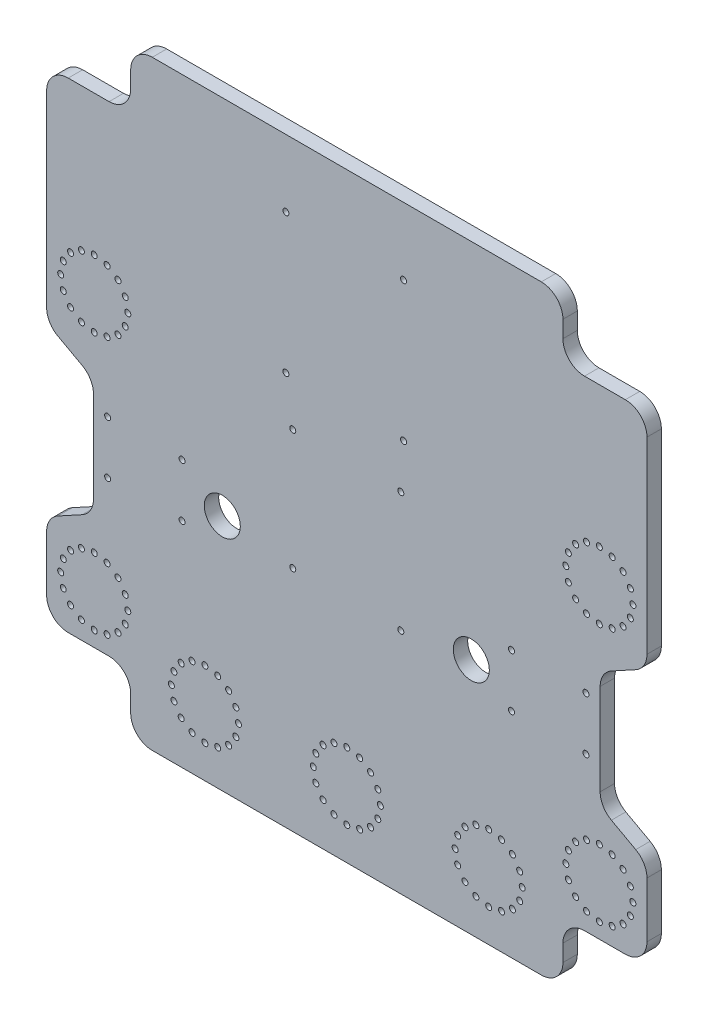
from build123d import *

# Parameters (mm, degrees)
SKETCH1_W               = 300
SKETCH1_H               = 250
BOSS_EXTRUDE1_DEPTH     = 6
CUT_EXTRUDE1_DEPTH      = 391.558574352
CUT_EXTRUDE1_DEPTH_BACK = 391.558574352
SKETCH3_R               = 7.5
SKETCH8_R               = 1.25
CUT_EXTRUDE4_DEPTH      = 382.041008292
SKETCH6_W               = 12.5
SKETCH6_H               = 92.656290199
SKETCH6_W_2             = 35
SKETCH6_H_2             = 25
CUT_EXTRUDE3_DEPTH      = 382.041008292
SKETCH5_R               = 1.25
CUT_EXTRUDE2_DEPTH      = 372.700147969
FILLET1_R               = 9


with BuildPart() as part:
    # Sketch1 → Boss-Extrude1 (new body)
    with BuildSketch(Plane.XY):
        with Locations((150, 125)):
            Rectangle(SKETCH1_W, SKETCH1_H)
    extrude(amount=-BOSS_EXTRUDE1_DEPTH)

    # Sketch3 → Cut-Extrude1 (cut, two sides: drawn at the far end of the back side and taken through both)
    with BuildSketch(Plane.XY.offset(-CUT_EXTRUDE1_DEPTH_BACK)):
        Polygon((0, 0), (25, 0), (25, 62.343709801), (44.5, 73.000027506), (44.5, 121.687392097), (25, 132.343709801), (12.5, 132.343709801), (12.5, 225), (25, 225), (25, 250), (0, 250), align=None)
        Polygon((275, 0), (300, 0), (300, 250), (275, 250), (275, 225), (287.5, 225), (287.5, 132.343709801), (275, 132.343709801), (255.5, 121.687392097), (255.5, 73.000027506), (275, 62.343709801), align=None)
        with Locations((201.85, 99.125843129)):
            Circle(SKETCH3_R)
        with Locations((98.15, 99.125843129)):
            Circle(SKETCH3_R)
    extrude(amount=CUT_EXTRUDE1_DEPTH + CUT_EXTRUDE1_DEPTH_BACK, mode=Mode.SUBTRACT)

    # Sketch8 → Cut-Extrude4 (cut, through all)
    with BuildSketch(Plane.XY):
        with Locations((209.09, 41.63)):
            Circle(SKETCH8_R)
        with Locations((209.09, 13.69)):
            Circle(SKETCH8_R)
        with Locations((214.43608755, 40.566597069)):
            Circle(SKETCH8_R)
        with Locations((203.74391245, 14.753402931)):
            Circle(SKETCH8_R)
        with Locations((218.968281733, 37.538281733)):
            Circle(SKETCH8_R)
        with Locations((199.211718267, 17.781718267)):
            Circle(SKETCH8_R)
        with Locations((221.996597069, 33.00608755)):
            Circle(SKETCH8_R)
        with Locations((196.183402931, 22.31391245)):
            Circle(SKETCH8_R)
        with Locations((223.06, 27.66)):
            Circle(SKETCH8_R)
        with Locations((195.12, 27.66)):
            Circle(SKETCH8_R)
        with Locations((221.996597069, 22.31391245)):
            Circle(SKETCH8_R)
        with Locations((196.183402931, 33.00608755)):
            Circle(SKETCH8_R)
        with Locations((218.968281733, 17.781718267)):
            Circle(SKETCH8_R)
        with Locations((199.211718267, 37.538281733)):
            Circle(SKETCH8_R)
        with Locations((214.43608755, 14.753402931)):
            Circle(SKETCH8_R)
        with Locations((203.74391245, 40.566597069)):
            Circle(SKETCH8_R)
        with Locations((76.94, 27.66)):
            Circle(SKETCH8_R)
        with Locations((104.88, 27.66)):
            Circle(SKETCH8_R)
        with Locations((255.16893536, 59.271223716)):
            Circle(SKETCH8_R)
        with Locations((103.816597069, 22.31391245)):
            Circle(SKETCH8_R)
        with Locations((78.003402931, 33.00608755)):
            Circle(SKETCH8_R)
        with Locations((100.788281733, 17.781718267)):
            Circle(SKETCH8_R)
        with Locations((81.031718267, 37.538281733)):
            Circle(SKETCH8_R)
        with Locations((96.25608755, 14.753402931)):
            Circle(SKETCH8_R)
        with Locations((85.56391245, 40.566597069)):
            Circle(SKETCH8_R)
        with Locations((90.91, 13.69)):
            Circle(SKETCH8_R)
        with Locations((90.91, 41.63)):
            Circle(SKETCH8_R)
        with Locations((85.56391245, 14.753402931)):
            Circle(SKETCH8_R)
        with Locations((96.25608755, 40.566597069)):
            Circle(SKETCH8_R)
        with Locations((81.031718267, 17.781718267)):
            Circle(SKETCH8_R)
        with Locations((100.788281733, 37.538281733)):
            Circle(SKETCH8_R)
        with Locations((78.003402931, 22.31391245)):
            Circle(SKETCH8_R)
        with Locations((103.816597069, 33.00608755)):
            Circle(SKETCH8_R)
        with Locations((255.16893536, 31.331223716)):
            Circle(SKETCH8_R)
        with Locations((260.51502291, 58.207820785)):
            Circle(SKETCH8_R)
        with Locations((249.82284781, 32.394626647)):
            Circle(SKETCH8_R)
        with Locations((265.047217093, 55.179505449)):
            Circle(SKETCH8_R)
        with Locations((245.290653627, 35.422941983)):
            Circle(SKETCH8_R)
        with Locations((268.075532429, 50.647311266)):
            Circle(SKETCH8_R)
        with Locations((242.262338291, 39.955136166)):
            Circle(SKETCH8_R)
        with Locations((269.13893536, 45.301223716)):
            Circle(SKETCH8_R)
        with Locations((241.19893536, 45.301223716)):
            Circle(SKETCH8_R)
        with Locations((268.075532429, 39.955136166)):
            Circle(SKETCH8_R)
        with Locations((242.262338291, 50.647311266)):
            Circle(SKETCH8_R)
        with Locations((265.047217093, 35.422941983)):
            Circle(SKETCH8_R)
        with Locations((245.290653627, 55.179505449)):
            Circle(SKETCH8_R)
        with Locations((260.51502291, 32.394626647)):
            Circle(SKETCH8_R)
        with Locations((249.82284781, 58.207820785)):
            Circle(SKETCH8_R)
        with Locations((44.83106464, 59.271223716)):
            Circle(SKETCH8_R)
        with Locations((44.83106464, 31.331223716)):
            Circle(SKETCH8_R)
        with Locations((50.17715219, 58.207820785)):
            Circle(SKETCH8_R)
        with Locations((39.48497709, 32.394626647)):
            Circle(SKETCH8_R)
        with Locations((54.709346373, 55.179505449)):
            Circle(SKETCH8_R)
        with Locations((34.952782907, 35.422941983)):
            Circle(SKETCH8_R)
        with Locations((57.737661709, 50.647311266)):
            Circle(SKETCH8_R)
        with Locations((31.924467571, 39.955136166)):
            Circle(SKETCH8_R)
        with Locations((58.80106464, 45.301223716)):
            Circle(SKETCH8_R)
        with Locations((30.86106464, 45.301223716)):
            Circle(SKETCH8_R)
        with Locations((57.737661709, 39.955136166)):
            Circle(SKETCH8_R)
        with Locations((31.924467571, 50.647311266)):
            Circle(SKETCH8_R)
        with Locations((54.709346373, 35.422941983)):
            Circle(SKETCH8_R)
        with Locations((34.952782907, 55.179505449)):
            Circle(SKETCH8_R)
        with Locations((50.17715219, 32.394626647)):
            Circle(SKETCH8_R)
        with Locations((39.48497709, 58.207820785)):
            Circle(SKETCH8_R)
        with Locations((255.16893536, 166.641143395)):
            Circle(SKETCH8_R)
        with Locations((255.16893536, 138.701143395)):
            Circle(SKETCH8_R)
        with Locations((249.82284781, 139.764546326)):
            Circle(SKETCH8_R)
        with Locations((260.51502291, 165.577740464)):
            Circle(SKETCH8_R)
        with Locations((245.290653627, 142.792861662)):
            Circle(SKETCH8_R)
        with Locations((265.047217093, 162.549425128)):
            Circle(SKETCH8_R)
        with Locations((242.262338291, 147.325055845)):
            Circle(SKETCH8_R)
        with Locations((268.075532429, 158.017230945)):
            Circle(SKETCH8_R)
        with Locations((241.19893536, 152.671143395)):
            Circle(SKETCH8_R)
        with Locations((269.13893536, 152.671143395)):
            Circle(SKETCH8_R)
        with Locations((242.262338291, 158.017230945)):
            Circle(SKETCH8_R)
        with Locations((268.075532429, 147.325055845)):
            Circle(SKETCH8_R)
        with Locations((245.290653627, 162.549425128)):
            Circle(SKETCH8_R)
        with Locations((265.047217093, 142.792861662)):
            Circle(SKETCH8_R)
        with Locations((249.82284781, 165.577740464)):
            Circle(SKETCH8_R)
        with Locations((260.51502291, 139.764546326)):
            Circle(SKETCH8_R)
        with Locations((44.83106464, 166.641143395)):
            Circle(SKETCH8_R)
        with Locations((44.83106464, 138.701143395)):
            Circle(SKETCH8_R)
        with Locations((39.48497709, 139.764546326)):
            Circle(SKETCH8_R)
        with Locations((50.17715219, 165.577740464)):
            Circle(SKETCH8_R)
        with Locations((34.952782907, 142.792861662)):
            Circle(SKETCH8_R)
        with Locations((54.709346373, 162.549425128)):
            Circle(SKETCH8_R)
        with Locations((31.924467571, 147.325055845)):
            Circle(SKETCH8_R)
        with Locations((57.737661709, 158.017230945)):
            Circle(SKETCH8_R)
        with Locations((30.86106464, 152.671143395)):
            Circle(SKETCH8_R)
        with Locations((58.80106464, 152.671143395)):
            Circle(SKETCH8_R)
        with Locations((31.924467571, 158.017230945)):
            Circle(SKETCH8_R)
        with Locations((57.737661709, 147.325055845)):
            Circle(SKETCH8_R)
        with Locations((34.952782907, 162.549425128)):
            Circle(SKETCH8_R)
        with Locations((54.709346373, 142.792861662)):
            Circle(SKETCH8_R)
        with Locations((39.48497709, 165.577740464)):
            Circle(SKETCH8_R)
        with Locations((50.17715219, 139.764546326)):
            Circle(SKETCH8_R)
        with Locations((150, 41.63)):
            Circle(SKETCH8_R)
        with Locations((150, 13.69)):
            Circle(SKETCH8_R)
        with Locations((155.34608755, 40.566597069)):
            Circle(SKETCH8_R)
        with Locations((144.65391245, 14.753402931)):
            Circle(SKETCH8_R)
        with Locations((159.878281733, 37.538281733)):
            Circle(SKETCH8_R)
        with Locations((140.121718267, 17.781718267)):
            Circle(SKETCH8_R)
        with Locations((162.906597069, 33.00608755)):
            Circle(SKETCH8_R)
        with Locations((137.093402931, 22.31391245)):
            Circle(SKETCH8_R)
        with Locations((163.97, 27.66)):
            Circle(SKETCH8_R)
        with Locations((136.03, 27.66)):
            Circle(SKETCH8_R)
        with Locations((162.906597069, 22.31391245)):
            Circle(SKETCH8_R)
        with Locations((137.093402931, 33.00608755)):
            Circle(SKETCH8_R)
        with Locations((159.878281733, 17.781718267)):
            Circle(SKETCH8_R)
        with Locations((140.121718267, 37.538281733)):
            Circle(SKETCH8_R)
        with Locations((155.34608755, 14.753402931)):
            Circle(SKETCH8_R)
        with Locations((144.65391245, 40.566597069)):
            Circle(SKETCH8_R)
    extrude(amount=-CUT_EXTRUDE4_DEPTH, mode=Mode.SUBTRACT)

    # Sketch6 → Cut-Extrude3 (cut, through all)
    with BuildSketch(Plane.XY):
        with Locations((281.25, 178.671854901)):
            Rectangle(SKETCH6_W, SKETCH6_H)
        with Locations((257.5, 237.5)):
            Rectangle(SKETCH6_W_2, SKETCH6_H_2)
        with Locations((257.5, 12.5)):
            Rectangle(SKETCH6_W_2, SKETCH6_H_2)
        with Locations((42.5, 12.5)):
            Rectangle(SKETCH6_W_2, SKETCH6_H_2)
        with Locations((42.5, 237.5)):
            Rectangle(SKETCH6_W_2, SKETCH6_H_2)
        with Locations((18.75, 178.671854901)):
            Rectangle(SKETCH6_W, SKETCH6_H)
    extrude(amount=-CUT_EXTRUDE3_DEPTH, mode=Mode.SUBTRACT)

    # Sketch5 → Cut-Extrude2 (cut, symmetric)
    with BuildSketch(Plane.XY):
        with Locations((50.4, 89.006293682)):
            Circle(SKETCH5_R)
    cut_extrude2 = extrude(amount=CUT_EXTRUDE2_DEPTH, both=True, mode=Mode.SUBTRACT)

    # Sketch-Pattern1: Cut-Extrude2 at 15 more places
    with Locations((77.1, 5.993706, 0), (122.1, 5.993706, 0), (77.1, 55.993706, 0), (122.1, 55.993706, 0), (74.245277, 75.015797, 0), (123.245277, 75.015797, 0), (74.245277, 133.015797, 0), (123.245277, 133.015797, 0), (168.2, 21.993706, 0), (199.2, 21.993706, 0), (199.2, -0.006294, 0), (168.2, -0.006294, 0), (31, 0, 0), (31, 22, 0), (0, 22, 0)):
        add(cut_extrude2, mode=Mode.SUBTRACT)

    # Fillet1
    fillet1_edges = [part.edges().sort_by_distance(p)[0] for p in [
        (255.5, 121.687392097, -3),
        (44.5, 121.687392097, -3),
        (44.5, 73.000027506, -3),
        (25, 62.343709801, -3),
        (255.5, 73.000027506, -3),
        (275, 62.343709801, -3),
        (240, 250, -3),
        (240, 225, -3),
        (60, 250, -3),
        (60, 225, -3),
        (60, 0, -3),
        (240, 0, -3),
        (275, 225, -3),
        (275, 132.343709801, -3),
        (25, 225, -3),
        (25, 132.343709801, -3),
        (60, 25, -3),
        (25, 25, -3),
        (275, 25, -3),
        (240, 25, -3),
    ]]
    fillet(fillet1_edges, radius=FILLET1_R)


solid = part.part
